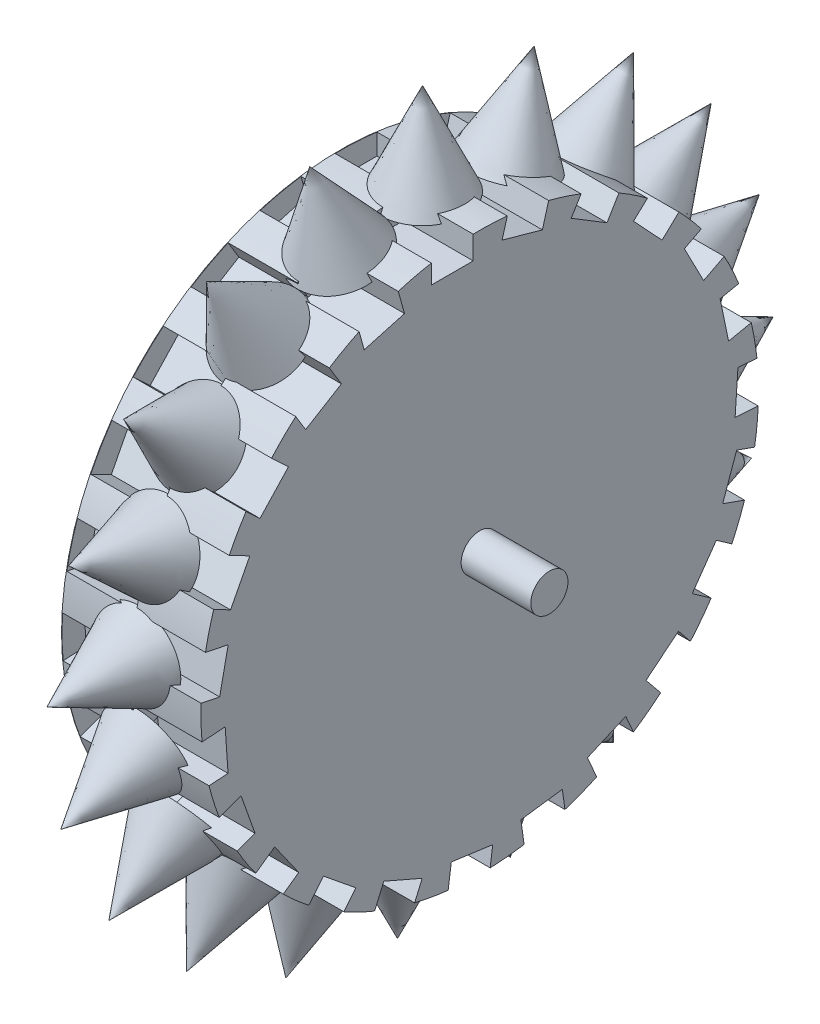
from build123d import *

# Parameters (mm, degrees)
BOSS_EXTRUDE1_DEPTH      = 20
BOSS_EXTRUDE1_DEPTH_BACK = 20
SKETCH1_R                = 60
SKETCH2_R                = 60
CUT_EXTRUDE1_DEPTH       = 5
SKETCH3_R                = 60
CUT_EXTRUDE2_DEPTH       = 5
SKETCH4_R                = 4
CUT_EXTRUDE3_DEPTH       = 33
SKETCH10_W               = 15
SKETCH10_H               = 9
CUT_EXTRUDE13_DEPTH      = 5
CIRPATTERN1_COUNT        = 23
CIRPATTERN29_COUNT       = 20
SKETCH17_R               = 4
BOSS_EXTRUDE2_DEPTH      = 30
SCALE3_SCALE             = 1.2


with BuildPart() as part:
    # Sketch1 → Boss-Extrude1 (new, two sides: drawn at the far end of the back side and taken through both)
    with BuildSketch(Plane(origin=(0, 0, 0), x_dir=(0, 0, -1), z_dir=(1, 0, 0)).offset(-BOSS_EXTRUDE1_DEPTH_BACK)):
        Circle(SKETCH1_R)
    extrude(amount=BOSS_EXTRUDE1_DEPTH + BOSS_EXTRUDE1_DEPTH_BACK)

    # Sketch2 → Cut-Extrude1 (cut)
    with BuildSketch(Plane(origin=(20, 0, 0), x_dir=(0, 0, -1), z_dir=(1, 0, 0))):
        Circle(SKETCH2_R)
    extrude(amount=-CUT_EXTRUDE1_DEPTH, mode=Mode.SUBTRACT)

    # Sketch3 → Cut-Extrude2 (cut)
    with BuildSketch(Plane.ZY.offset(20)):
        with Locations(Location((0, 0, 0), (0, 0, 180))):
            Circle(SKETCH3_R)
    extrude(amount=-CUT_EXTRUDE2_DEPTH, mode=Mode.SUBTRACT)

    # Sketch4 → Cut-Extrude3 (cut)
    with BuildSketch(Plane.ZY.offset(15)):
        Circle(SKETCH4_R)
    extrude(amount=-CUT_EXTRUDE3_DEPTH, mode=Mode.SUBTRACT)

    # Sketch10 → Cut-Extrude13 (cut)
    with BuildSketch(Plane(origin=(0, 60, 0), x_dir=(1, 0, 0), z_dir=(0, 1, 0))):
        with Locations((7.5, -5.895195854)):
            Rectangle(SKETCH10_W, SKETCH10_H)
        with Locations((-7.387769065, 3.272915262)):
            Rectangle(SKETCH10_W, SKETCH10_H)
    cut_extrude13 = extrude(amount=-CUT_EXTRUDE13_DEPTH, mode=Mode.SUBTRACT)

    # CirPattern1: Cut-Extrude13 ×23 about axis
    cirpattern1_axis = Axis((0, 0, 0), (1, 0, 0))
    for i in range(1, CIRPATTERN1_COUNT):
        add(cut_extrude13.rotate(cirpattern1_axis, i * 360 / CIRPATTERN1_COUNT), mode=Mode.SUBTRACT)

    # Sketch16 → Revolve2 (revolve)
    with BuildSketch(Plane(origin=(0, 0, 0), x_dir=(0, 0, -1), z_dir=(1, 0, 0)), mode=Mode.PRIVATE) as revolve2_sk:
        Polygon((78.153887526, -2.701494333), (58.445763379, 6.421686343), (59.939151882, -2.701494333), align=None)
    revolve2 = revolve(revolve2_sk.sketch.rotate(Axis((0, -2.701494333, -59.939151882), (0, 0, -1)), 180), axis=Axis((0, -2.701494333, -59.939151882), (0, 0, -1)))

    # CirPattern29: Revolve2 ×20 about axis
    cirpattern29_axis = Axis((-20, 0, 0), (1, 0, 0))
    for i in range(1, CIRPATTERN29_COUNT):
        add(revolve2.rotate(cirpattern29_axis, i * 360 / CIRPATTERN29_COUNT))

    # Sketch17 → Boss-Extrude2 (add)
    with BuildSketch(Plane(origin=(0, 0, 0), x_dir=(0, 0, -1), z_dir=(1, 0, 0))):
        with Locations(Location((0, 0, 0), (0, 0, 180))):
            Circle(SKETCH17_R)
    extrude(amount=BOSS_EXTRUDE2_DEPTH)


with BuildPart() as part_1:
    # Scale3: scaled about (0.075451283, 2.431e-05, -0.000112493)
    add(part.part.scale(SCALE3_SCALE).moved(Location((-0.015090257, -4.862e-06, 2.2499e-05))))


solid = part_1.part
